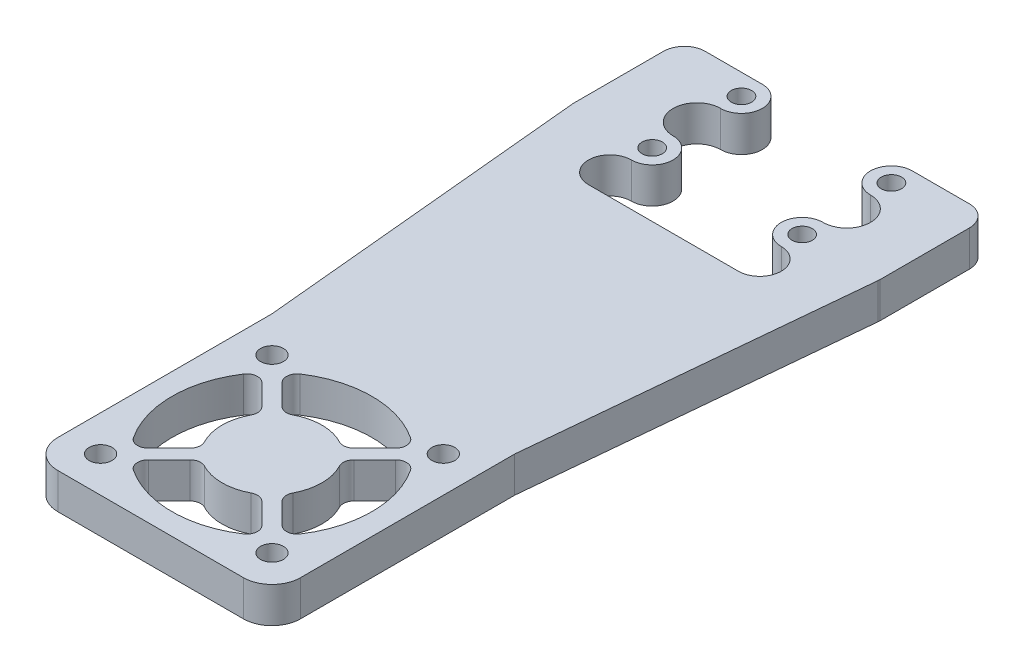
from build123d import *

# Parameters (mm, degrees)
SKETCH1_R                = 1.6
SKETCH1_R_2              = 1.425
BOSS_EXTRUDE1_DEPTH      = 5
FILLET1_R                = 4
CUT_EXTRUDE1_DEPTH       = 83.174882111
FILLET2_R                = 1.5
CIRPATTERN1_COUNT        = 4
FILLET2_OF_CIRPATTERN1_R = 1.5


with BuildPart() as part:
    # Sketch1 → Boss-Extrude1 (new body)
    with BuildSketch(Plane(origin=(0, 0, 0), x_dir=(1, 0, 0), z_dir=(0, 1, 0))):
        with BuildLine():
            Line((-17, 17), (-17, -17))
            Line((-17, -17), (17, -17))
            Line((17, -17), (17, 17))
            Line((17, 17), (21.411907779, 63.473561783))
            ThreePointArc((21.411907779, 63.473561783), (21.421725111, 63.611625965), (21.425, 63.75))
            Line((21.425, 63.75), (21.425, 76.25))
            ThreePointArc((21.425, 76.25), (20.568287335, 78.318287335), (18.5, 79.175))
            Line((18.5, 79.175), (10.5, 79.175))
            ThreePointArc((10.5, 79.175), (7.575, 76.25), (10.5, 73.325))
            ThreePointArc((10.5, 73.325), (13.825, 70), (10.5, 66.675))
            ThreePointArc((10.5, 66.675), (7.575, 63.75), (10.5, 60.825))
            ThreePointArc((10.5, 60.825), (13.5, 57.825), (10.5, 54.825))
            Line((10.5, 54.825), (-10.5, 54.825))
            ThreePointArc((-10.5, 54.825), (-13.5, 57.825), (-10.5, 60.825))
            ThreePointArc((-10.5, 60.825), (-7.575, 63.75), (-10.5, 66.675))
            ThreePointArc((-10.5, 66.675), (-13.825, 70), (-10.5, 73.325))
            ThreePointArc((-10.5, 73.325), (-7.575, 76.25), (-10.5, 79.175))
            Line((-10.5, 79.175), (-18.5, 79.175))
            ThreePointArc((-18.5, 79.175), (-20.568287335, 78.318287335), (-21.425, 76.25))
            Line((-21.425, 76.25), (-21.425, 63.75))
            ThreePointArc((-21.425, 63.75), (-21.421725111, 63.611625965), (-21.411907779, 63.473561783))
            Line((-21.411907779, 63.473561783), (-17, 17))
        make_face()
        with Locations((-12, -12)):
            Circle(SKETCH1_R, mode=Mode.SUBTRACT)
        with Locations((-12, 12)):
            Circle(SKETCH1_R, mode=Mode.SUBTRACT)
        with Locations((12, -12)):
            Circle(SKETCH1_R, mode=Mode.SUBTRACT)
        with Locations((12, 12)):
            Circle(SKETCH1_R, mode=Mode.SUBTRACT)
        with Locations((-10.5, 63.75)):
            Circle(SKETCH1_R_2, mode=Mode.SUBTRACT)
        with Locations((10.5, 63.75)):
            Circle(SKETCH1_R_2, mode=Mode.SUBTRACT)
        with Locations((-10.5, 76.25)):
            Circle(SKETCH1_R_2, mode=Mode.SUBTRACT)
        with Locations((10.5, 76.25)):
            Circle(SKETCH1_R_2, mode=Mode.SUBTRACT)
    extrude(amount=BOSS_EXTRUDE1_DEPTH)

    # Fillet1
    fillet1_edges = [part.edges().sort_by_distance(p)[0] for p in [
        (17, 2.5, 17),
        (-17, 2.5, 17),
    ]]
    fillet(fillet1_edges, radius=FILLET1_R)

    # Sketch2 → Cut-Extrude1 (cut, symmetric)
    with BuildSketch(Plane(origin=(0, 5, 0), x_dir=(1, 0, 0), z_dir=(0, 1, 0))):
        with BuildLine():
            ThreePointArc((9.167102048, 10.58131561), (0, 14), (-9.167102048, 10.58131561))
            Line((-9.167102048, 10.58131561), (-4.191872704, 5.606086267))
            ThreePointArc((-4.191872704, 5.606086267), (0, 7), (4.191872704, 5.606086267))
            Line((4.191872704, 5.606086267), (9.167102048, 10.58131561))
        make_face()
    cut_extrude1 = extrude(amount=CUT_EXTRUDE1_DEPTH, both=True, mode=Mode.SUBTRACT)

    # Fillet2
    fillet2_edges = [part.edges().sort_by_distance(p)[0] for p in [
        (-4.191872704, 2.5, -5.606086267),
        (9.167102048, 2.5, -10.58131561),
        (4.191872704, 2.5, -5.606086267),
        (-9.167102048, 2.5, -10.58131561),
    ]]
    fillet(fillet2_edges, radius=FILLET2_R)

    # CirPattern1: Cut-Extrude1 ×4 about axis
    cirpattern1_axis = Axis((0, 0, 0), (0, 1, 0))
    for i in range(1, CIRPATTERN1_COUNT):
        add(cut_extrude1.rotate(cirpattern1_axis, i * 360 / CIRPATTERN1_COUNT), mode=Mode.SUBTRACT)

    # Fillet2 of CirPattern1
    fillet2_of_cirpattern1_edges = [part.edges().sort_by_distance(p)[0] for p in [
        (-5.606086267, 2.5, 4.191872704),
        (-10.58131561, 2.5, -9.167102048),
        (-5.606086267, 2.5, -4.191872704),
        (-10.58131561, 2.5, 9.167102048),
        (4.191872704, 2.5, 5.606086267),
        (-9.167102048, 2.5, 10.58131561),
        (-4.191872704, 2.5, 5.606086267),
        (9.167102048, 2.5, 10.58131561),
        (5.606086267, 2.5, -4.191872704),
        (10.58131561, 2.5, 9.167102048),
        (5.606086267, 2.5, 4.191872704),
        (10.58131561, 2.5, -9.167102048),
    ]]
    fillet(fillet2_of_cirpattern1_edges, radius=FILLET2_OF_CIRPATTERN1_R)


solid = part.part
